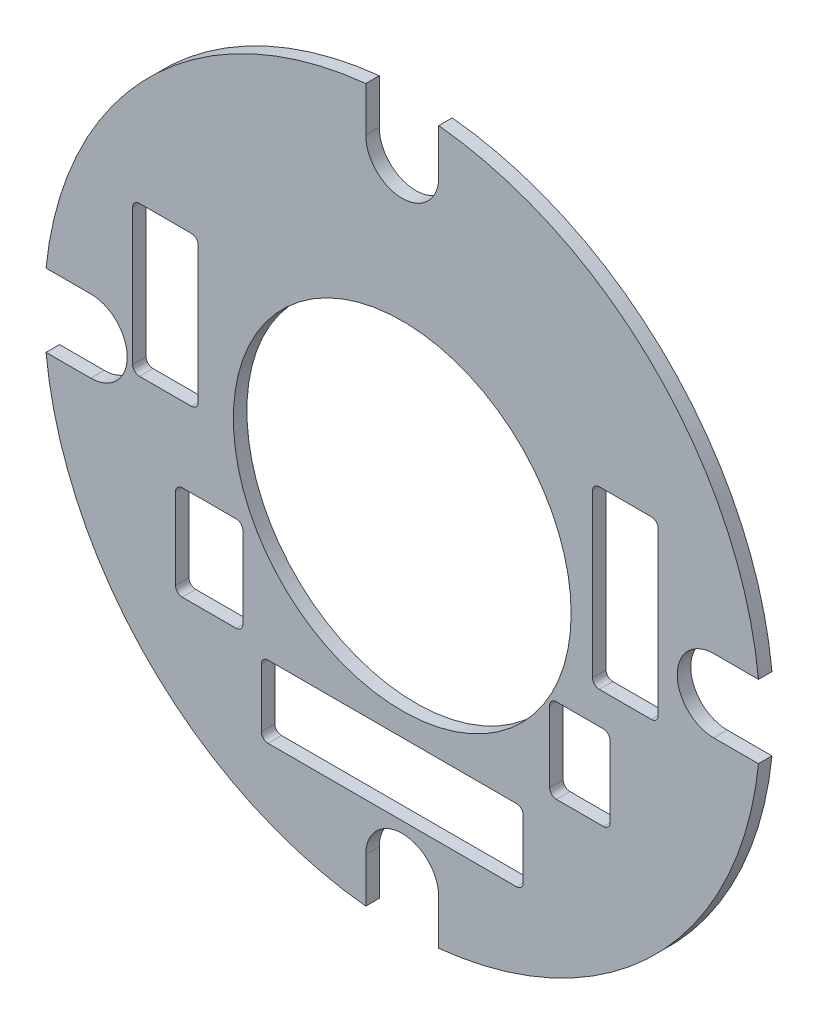
from build123d import *

# Parameters (mm, degrees)
SKETCH_1_R          = 26.5
SKETCH_1_R_2        = 12.5
EXTRUDE_1_DEPTH     = 1
CUT_EXTRUDE_1_REACH = 66.56
CUT_EXTRUDE_START   = 3.5
CUT_EXTRUDE_2_REACH = 66.56
SKETCH_3_R          = 1.52
CUT_EXTRUDE_4_DEPTH = 10


with BuildPart() as part:
    # 草图1 → 凸台-拉伸1 (new body)
    with BuildSketch(Plane.XY):
        Circle(SKETCH_1_R)
        Circle(SKETCH_1_R_2, mode=Mode.SUBTRACT)
    extrude(amount=EXTRUDE_1_DEPTH)

    # 草图2 → 切除-拉伸1 (cut, up to next)
    with BuildSketch(Plane(origin=(22.803986485, -9.350307143, -2.5), x_dir=(1, 0, 0), z_dir=(0, 0, 1)).offset(CUT_EXTRUDE_START), mode=Mode.PRIVATE) as cut_extrude_1_sk1:
        with BuildLine():
            Line((-38.401990025, 19.652309401), (-42.257990025, 19.652309401))
            ThreePointArc((-42.257990025, 19.652309401), (-42.611543416, 19.505862792), (-42.757990025, 19.152309401))
            Line((-42.757990025, 19.152309401), (-42.757990025, 9.073309401))
            ThreePointArc((-42.757990025, 9.073309401), (-42.611543416, 8.719756011), (-42.257990025, 8.573309401))
            Line((-42.257990025, 8.573309401), (-38.401990025, 8.573309401))
            ThreePointArc((-38.401990025, 8.573309401), (-38.048436635, 8.719756011), (-37.901990025, 9.073309401))
            Line((-37.901990025, 9.073309401), (-37.901990025, 19.152309401))
            ThreePointArc((-37.901990025, 19.152309401), (-38.048436635, 19.505862792), (-38.401990025, 19.652309401))
        make_face()
    cut_extrude_1_tool1 = extrude(cut_extrude_1_sk1.sketch, amount=-CUT_EXTRUDE_1_REACH, mode=Mode.PRIVATE) & part.part
    # 草图2 → 切除-拉伸1 (cut, up to next)
    with BuildSketch(Plane(origin=(22.803986485, -9.350307143, -2.5), x_dir=(1, 0, 0), z_dir=(0, 0, 1)).offset(CUT_EXTRUDE_START), mode=Mode.PRIVATE) as cut_extrude_1_sk2:
        with BuildLine():
            Line((-8.221986913, 18.50930464), (-4.365986913, 18.50930464))
            ThreePointArc((-4.365986913, 18.50930464), (-4.012433522, 18.362858031), (-3.865986913, 18.00930464))
            Line((-3.865986913, 18.00930464), (-3.865986913, 6.02530464))
            ThreePointArc((-3.865986913, 6.02530464), (-4.012433522, 5.67175125), (-4.365986913, 5.52530464))
            Line((-4.365986913, 5.52530464), (-8.221986913, 5.52530464))
            ThreePointArc((-8.221986913, 5.52530464), (-8.575540303, 5.67175125), (-8.721986913, 6.02530464))
            Line((-8.721986913, 6.02530464), (-8.721986913, 18.00930464))
            ThreePointArc((-8.721986913, 18.00930464), (-8.575540303, 18.362858031), (-8.221986913, 18.50930464))
        make_face()
    cut_extrude_1_tool2 = extrude(cut_extrude_1_sk2.sketch, amount=-CUT_EXTRUDE_1_REACH, mode=Mode.PRIVATE) & part.part
    # 草图2 → 切除-拉伸1 (cut, up to next)
    with BuildSketch(Plane(origin=(22.803986485, -9.350307143, -2.5), x_dir=(1, 0, 0), z_dir=(0, 0, 1)).offset(CUT_EXTRUDE_START), mode=Mode.PRIVATE) as cut_extrude_1_sk3:
        with BuildLine():
            Line((-32.732983006, -4.858695665), (-14.351988011, -4.858695665))
            ThreePointArc((-14.351988011, -4.858695665), (-13.998434621, -5.005142274), (-13.851988011, -5.358695665))
            Line((-13.851988011, -5.358695665), (-13.851988011, -9.690695176))
            ThreePointArc((-13.851988011, -9.690695176), (-13.998434621, -10.044248567), (-14.351988011, -10.190695176))
            Line((-14.351988011, -10.190695176), (-32.732983006, -10.190695176))
            ThreePointArc((-32.732983006, -10.190695176), (-33.086536397, -10.044248567), (-33.232983006, -9.690695176))
            Line((-33.232983006, -9.690695176), (-33.232983006, -5.358695665))
            ThreePointArc((-33.232983006, -5.358695665), (-33.086536397, -5.005142274), (-32.732983006, -4.858695665))
        make_face()
    cut_extrude_1_tool3 = extrude(cut_extrude_1_sk3.sketch, amount=-CUT_EXTRUDE_1_REACH, mode=Mode.PRIVATE) & part.part
    # 草图2 → 切除-拉伸1 (cut, up to next)
    with BuildSketch(Plane(origin=(22.803986485, -9.350307143, -2.5), x_dir=(1, 0, 0), z_dir=(0, 0, 1)).offset(CUT_EXTRUDE_START), mode=Mode.PRIVATE) as cut_extrude_1_sk4:
        with BuildLine():
            Line((-35.099987523, 3.015306044), (-39.082987523, 3.015306044))
            ThreePointArc((-39.082987523, 3.015306044), (-39.436540913, 2.868859435), (-39.582987523, 2.515306044))
            Line((-39.582987523, 2.515306044), (-39.582987523, -3.499693956))
            ThreePointArc((-39.582987523, -3.499693956), (-39.436540913, -3.853247346), (-39.082987523, -3.999693956))
            Line((-39.082987523, -3.999693956), (-35.099987523, -3.999693956))
            ThreePointArc((-35.099987523, -3.999693956), (-34.746434132, -3.853247346), (-34.599987523, -3.499693956))
            Line((-34.599987523, -3.499693956), (-34.599987523, 2.515306044))
            ThreePointArc((-34.599987523, 2.515306044), (-34.746434132, 2.868859435), (-35.099987523, 3.015306044))
        make_face()
    cut_extrude_1_tool4 = extrude(cut_extrude_1_sk4.sketch, amount=-CUT_EXTRUDE_1_REACH, mode=Mode.PRIVATE) & part.part
    # 草图2 → 切除-拉伸1 (cut, up to next)
    with BuildSketch(Plane(origin=(22.803986485, -9.350307143, -2.5), x_dir=(1, 0, 0), z_dir=(0, 0, 1)).offset(CUT_EXTRUDE_START), mode=Mode.PRIVATE) as cut_extrude_1_sk5:
        with BuildLine():
            Line((-11.396988316, 3.142309279), (-7.921988316, 3.142309279))
            ThreePointArc((-7.921988316, 3.142309279), (-7.568434926, 2.99586267), (-7.421988316, 2.642309279))
            Line((-7.421988316, 2.642309279), (-7.421988316, -2.610690721))
            ThreePointArc((-7.421988316, -2.610690721), (-7.568434926, -2.964244111), (-7.921988316, -3.110690721))
            Line((-7.921988316, -3.110690721), (-11.396988316, -3.110690721))
            ThreePointArc((-11.396988316, -3.110690721), (-11.750541707, -2.964244111), (-11.896988316, -2.610690721))
            Line((-11.896988316, -2.610690721), (-11.896988316, 2.642309279))
            ThreePointArc((-11.896988316, 2.642309279), (-11.750541707, 2.99586267), (-11.396988316, 3.142309279))
        make_face()
    cut_extrude_1_tool5 = extrude(cut_extrude_1_sk5.sketch, amount=-CUT_EXTRUDE_1_REACH, mode=Mode.PRIVATE) & part.part
    add(cut_extrude_1_tool1.solids().sort_by_distance((-17.526004, 4.762502, 1))[0], mode=Mode.SUBTRACT)
    add(cut_extrude_1_tool2.solids().sort_by_distance((16.51, 2.666997, 1))[0], mode=Mode.SUBTRACT)
    add(cut_extrude_1_tool3.solids().sort_by_distance((-0.738499, -16.875003, 1))[0], mode=Mode.SUBTRACT)
    add(cut_extrude_1_tool4.solids().sort_by_distance((-14.287501, -9.842501, 1))[0], mode=Mode.SUBTRACT)
    add(cut_extrude_1_tool5.solids().sort_by_distance((13.144498, -9.334498, 1))[0], mode=Mode.SUBTRACT)

    # 草图3 → 切除-拉伸2 (cut, up to next)
    with BuildSketch(Plane(origin=(22.803986485, -9.350307143, -2.5), x_dir=(1, 0, 0), z_dir=(0, 0, 1)).offset(CUT_EXTRUDE_START), mode=Mode.PRIVATE) as cut_extrude_2_sk1:
        with Locations((-22.803986485, 32.400306763)):
            Circle(SKETCH_3_R)
    cut_extrude_2_tool1 = extrude(cut_extrude_2_sk1.sketch, amount=-CUT_EXTRUDE_2_REACH, mode=Mode.PRIVATE) & part.part
    # 草图3 → 切除-拉伸2 (cut, up to next)
    with BuildSketch(Plane(origin=(22.803986485, -9.350307143, -2.5), x_dir=(1, 0, 0), z_dir=(0, 0, 1)).offset(CUT_EXTRUDE_START), mode=Mode.PRIVATE) as cut_extrude_2_sk2:
        with Locations((-45.853986105, 9.350307143)):
            Circle(SKETCH_3_R)
    cut_extrude_2_tool2 = extrude(cut_extrude_2_sk2.sketch, amount=-CUT_EXTRUDE_2_REACH, mode=Mode.PRIVATE) & part.part
    # 草图3 → 切除-拉伸2 (cut, up to next)
    with BuildSketch(Plane(origin=(22.803986485, -9.350307143, -2.5), x_dir=(1, 0, 0), z_dir=(0, 0, 1)).offset(CUT_EXTRUDE_START), mode=Mode.PRIVATE) as cut_extrude_2_sk3:
        with Locations((-22.803986485, -13.699692477)):
            Circle(SKETCH_3_R)
    cut_extrude_2_tool3 = extrude(cut_extrude_2_sk3.sketch, amount=-CUT_EXTRUDE_2_REACH, mode=Mode.PRIVATE) & part.part
    # 草图3 → 切除-拉伸2 (cut, up to next)
    with BuildSketch(Plane(origin=(22.803986485, -9.350307143, -2.5), x_dir=(1, 0, 0), z_dir=(0, 0, 1)).offset(CUT_EXTRUDE_START), mode=Mode.PRIVATE) as cut_extrude_2_sk4:
        with Locations((0.246013135, 9.350307143)):
            Circle(SKETCH_3_R)
    cut_extrude_2_tool4 = extrude(cut_extrude_2_sk4.sketch, amount=-CUT_EXTRUDE_2_REACH, mode=Mode.PRIVATE) & part.part
    add(cut_extrude_2_tool1.solids().sort_by_distance((0, 23.05, 1))[0], mode=Mode.SUBTRACT)
    add(cut_extrude_2_tool2.solids().sort_by_distance((-23.05, 0, 1))[0], mode=Mode.SUBTRACT)
    add(cut_extrude_2_tool3.solids().sort_by_distance((0, -23.05, 1))[0], mode=Mode.SUBTRACT)
    add(cut_extrude_2_tool4.solids().sort_by_distance((23.05, 0, 1))[0], mode=Mode.SUBTRACT)

    # 草图4 → 切除-拉伸4 (cut)
    with BuildSketch(Plane.XY):
        with BuildLine():
            Line((-2.7, 23.04999962), (-2.7, 28.124327142))
            Line((-2.7, 28.124327142), (2.7, 28.124327142))
            Line((2.7, 28.124327142), (2.7, 23.04999962))
            ThreePointArc((2.7, 23.04999962), (0, 20.34999962), (-2.7, 23.04999962))
        make_face()
        with BuildLine():
            Line((23.04999962, 2.7), (28.124327142, 2.7))
            Line((28.124327142, 2.7), (28.124327142, -2.7))
            Line((28.124327142, -2.7), (23.04999962, -2.7))
            ThreePointArc((23.04999962, -2.7), (20.34999962, 0), (23.04999962, 2.7))
        make_face()
        with BuildLine():
            Line((2.7, -23.04999962), (2.7, -28.124327142))
            Line((2.7, -28.124327142), (-2.7, -28.124327142))
            Line((-2.7, -28.124327142), (-2.7, -23.04999962))
            ThreePointArc((-2.7, -23.04999962), (0, -20.34999962), (2.7, -23.04999962))
        make_face()
        with BuildLine():
            Line((-23.04999962, -2.7), (-28.124327142, -2.7))
            Line((-28.124327142, -2.7), (-28.124327142, 2.7))
            Line((-28.124327142, 2.7), (-23.04999962, 2.7))
            ThreePointArc((-23.04999962, 2.7), (-20.34999962, 0), (-23.04999962, -2.7))
        make_face()
    extrude(amount=CUT_EXTRUDE_4_DEPTH, mode=Mode.SUBTRACT)


solid = part.part
